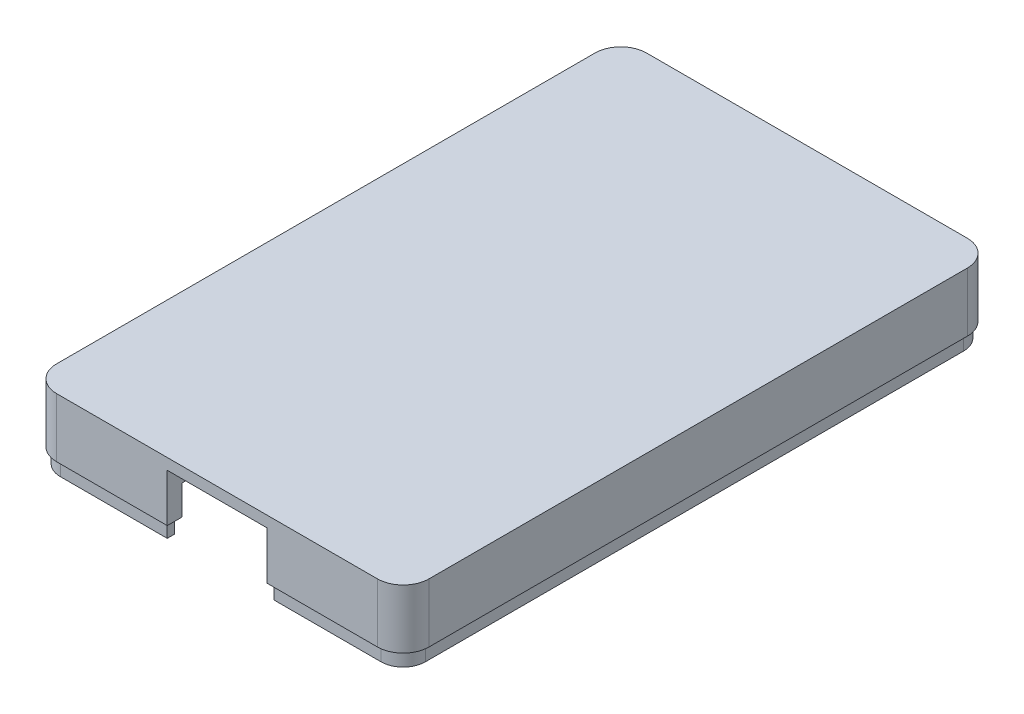
from build123d import *

# Parameters (mm, degrees)
BOSS_EXTRUDE1_DEPTH     = 8
CUT_EXTRUDE1_DEPTH      = 4
SKETCH3_W               = 13.5
SKETCH3_H               = 13
CUT_EXTRUDE2_DEPTH      = 15
SALIENTE_EXTRUIR1_DEPTH = 2


with BuildPart() as part:
    # Sketch1 → Boss-Extrude1 (new body)
    with BuildSketch(Plane(origin=(0, 0, 0), x_dir=(1, 0, 0), z_dir=(0, 1, 0))):
        with BuildLine():
            Line((-21.75, -40), (21.75, -40))
            ThreePointArc((21.75, -40), (24.224873734, -38.974873734), (25.25, -36.5))
            Line((25.25, -36.5), (25.25, 36.5))
            ThreePointArc((25.25, 36.5), (24.224873734, 38.974873734), (21.75, 40))
            Line((21.75, 40), (-21.75, 40))
            ThreePointArc((-21.75, 40), (-24.224873734, 38.974873734), (-25.25, 36.5))
            Line((-25.25, 36.5), (-25.25, -36.5))
            ThreePointArc((-25.25, -36.5), (-24.224873734, -38.974873734), (-21.75, -40))
        make_face()
    extrude(amount=BOSS_EXTRUDE1_DEPTH)

    # Sketch2 → Cut-Extrude1 (cut)
    with BuildSketch(Plane.XZ):
        with BuildLine():
            Line((-19.75, -38), (19.75, -38))
            ThreePointArc((19.75, -38), (22.224873734, -36.974873734), (23.25, -34.5))
            Line((23.25, -34.5), (23.25, 34.5))
            ThreePointArc((23.25, 34.5), (22.224873734, 36.974873734), (19.75, 38))
            Line((19.75, 38), (-19.75, 38))
            ThreePointArc((-19.75, 38), (-22.224873734, 36.974873734), (-23.25, 34.5))
            Line((-23.25, 34.5), (-23.25, -34.5))
            ThreePointArc((-23.25, -34.5), (-22.224873734, -36.974873734), (-19.75, -38))
        make_face()
    extrude(amount=-CUT_EXTRUDE1_DEPTH, mode=Mode.SUBTRACT)

    # Sketch3 → Cut-Extrude2 (cut)
    with BuildSketch(Plane.XY.offset(40)):
        Rectangle(SKETCH3_W, SKETCH3_H)
    extrude(amount=-CUT_EXTRUDE2_DEPTH, mode=Mode.SUBTRACT)

    # Croquis3 → Saliente-Extruir1 (add)
    with BuildSketch(Plane.XZ):
        with BuildLine():
            Line((7.25, 38.5), (19.75, 38.5))
            ThreePointArc((19.75, 38.5), (22.578427125, 37.328427125), (23.75, 34.5))
            Line((23.75, 34.5), (23.75, -34.5))
            ThreePointArc((23.75, -34.5), (22.578427125, -37.328427125), (19.75, -38.5))
            Line((19.75, -38.5), (-19.75, -38.5))
            ThreePointArc((-19.75, -38.5), (-22.578427125, -37.328427125), (-23.75, -34.5))
            Line((-23.75, -34.5), (-23.75, 34.5))
            ThreePointArc((-23.75, 34.5), (-22.578427125, 37.328427125), (-19.75, 38.5))
            Line((-19.75, 38.5), (-7.25, 38.5))
            Line((-7.25, 38.5), (-7.25, 39.5))
            Line((-7.25, 39.5), (-21.75, 39.5))
            ThreePointArc((-21.75, 39.5), (-23.871320344, 38.621320344), (-24.75, 36.5))
            Line((-24.75, 36.5), (-24.75, -36.5))
            ThreePointArc((-24.75, -36.5), (-23.871320344, -38.621320344), (-21.75, -39.5))
            Line((-21.75, -39.5), (21.75, -39.5))
            ThreePointArc((21.75, -39.5), (23.871320344, -38.621320344), (24.75, -36.5))
            Line((24.75, -36.5), (24.75, 36.5))
            ThreePointArc((24.75, 36.5), (23.871320344, 38.621320344), (21.75, 39.5))
            Line((21.75, 39.5), (7.25, 39.5))
            Line((7.25, 39.5), (7.25, 38.5))
        make_face()
    extrude(amount=SALIENTE_EXTRUIR1_DEPTH)


solid = part.part
